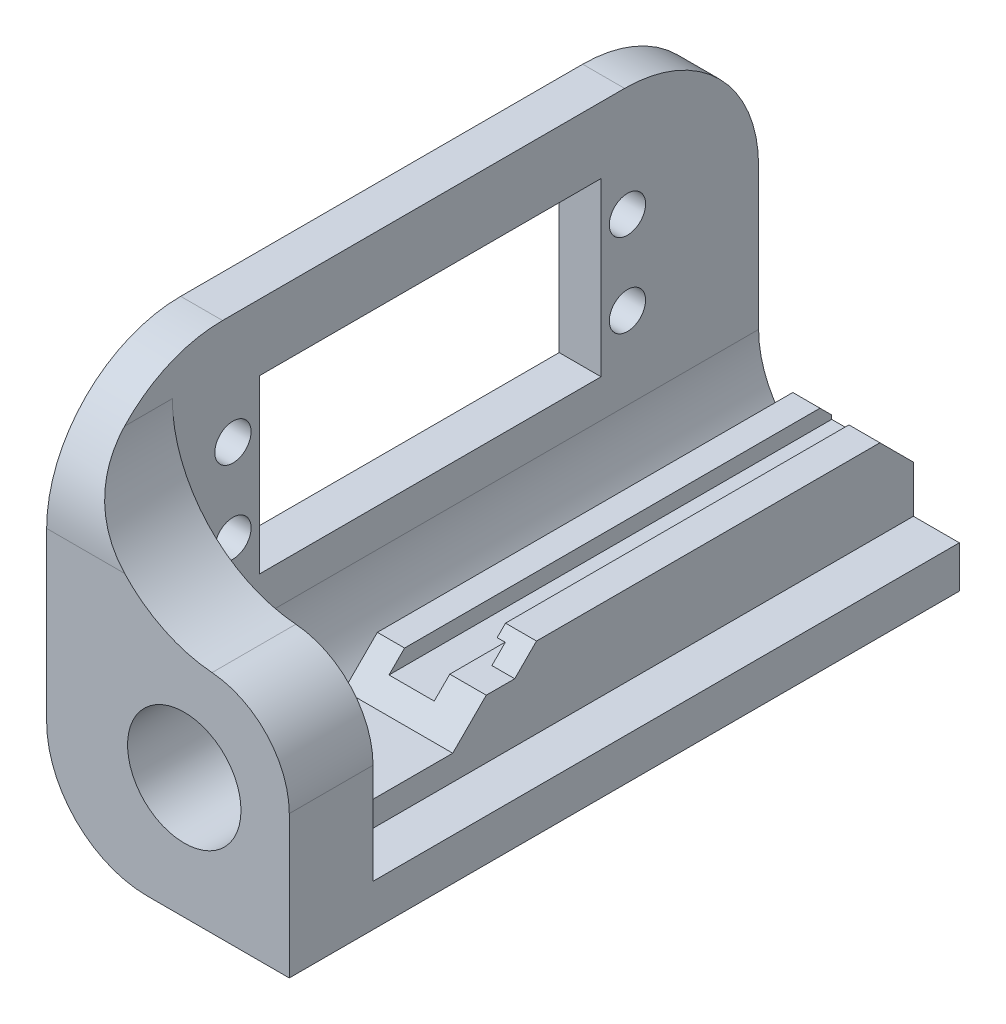
from build123d import *

# Parameters (mm, degrees)
CROQUIS1_W              = 90
CROQUIS1_H              = 80
SALIENTE_EXTRUIR1_DEPTH = 50
CROQUIS2_W              = 85
CROQUIS2_H              = 80
CORTAR_EXTRUIR1_DEPTH   = 23
CROQUIS3_W              = 61.032840672
CROQUIS3_H              = 80
CORTAR_EXTRUIR2_DEPTH   = 32
CROQUIS4_W              = 23.967159328
CROQUIS4_H              = 70
CORTAR_EXTRUIR3_DEPTH   = 22
CROQUIS7_R              = 6.77
CORTAR_EXTRUIR6_DEPTH   = 10
CROQUIS11_W             = 13
CROQUIS11_H             = 70
SALIENTE_EXTRUIR2_DEPTH = 2
CROQUIS12_W             = 13
CROQUIS12_H             = 55
SALIENTE_EXTRUIR3_DEPTH = 5
REDONDEO3_R             = 12
REDONDEO4_R             = 12
CROQUIS14_W             = 13
CROQUIS14_H             = 13
SALIENTE_EXTRUIR4_DEPTH = 1
CROQUIS17_W             = 2.726828244
CROQUIS17_H             = 50
SALIENTE_EXTRUIR5_DEPTH = 1.6
CROQUIS18_W             = 5
CROQUIS18_H             = 50
SALIENTE_EXTRUIR6_DEPTH = 1
CHAFL_N2_SIZE           = 4
CHAFL_N4_SIZE           = 4
CROQUIS19_R             = 2.165
CORTAR_EXTRUIR10_DEPTH  = 10
CROQUIS20_W             = 5.4
CROQUIS20_H             = 1.857846889
CORTAR_EXTRUIR11_DEPTH  = 80
REDONDEO10_R            = 10
CROQUIS23_W             = 40.8
CROQUIS23_H             = 20.5
CORTAR_EXTRUIR12_DEPTH  = 22
CROQUIS24_W             = 5
CROQUIS24_H             = 80
CORTAR_EXTRUIR14_DEPTH  = 2
REDONDEO13_R            = 16
REDONDEO14_START        = 30
REDONDEO14_DEPTH        = 2.2192
REDONDEO14_START_2      = 32.2192
REDONDEO14_2_DEPTH      = 7.7808
REDONDEO14_START_3      = -40
REDONDEO14_3_DEPTH      = 14.749021125
CORTAR_EXTRUIR16_DEPTH  = 1.3
CHAFL_N5_SIZE           = 5


with BuildPart() as part:
    # Croquis1 → Saliente-Extruir1 (new body)
    with BuildSketch(Plane(origin=(0, 0, 0), x_dir=(1, 0, 0), z_dir=(0, 1, 0))):
        Rectangle(CROQUIS1_W, CROQUIS1_H)
    extrude(amount=SALIENTE_EXTRUIR1_DEPTH)

    # Croquis2 → Cortar-Extruir1 (cut)
    with BuildSketch(Plane(origin=(0, 50, 0), x_dir=(1, 0, 0), z_dir=(0, 1, 0))):
        with Locations((2.5, 0)):
            Rectangle(CROQUIS2_W, CROQUIS2_H)
    extrude(amount=-CORTAR_EXTRUIR1_DEPTH, mode=Mode.SUBTRACT)

    # Croquis3 → Cortar-Extruir2 (cut)
    with BuildSketch(Plane(origin=(0, 27, 0), x_dir=(1, 0, 0), z_dir=(0, 1, 0))):
        with Locations((14.483579664, 0)):
            Rectangle(CROQUIS3_W, CROQUIS3_H)
    extrude(amount=-CORTAR_EXTRUIR2_DEPTH, mode=Mode.SUBTRACT)

    # Croquis4 → Cortar-Extruir3 (cut)
    with BuildSketch(Plane(origin=(0, 27, 0), x_dir=(1, 0, 0), z_dir=(0, 1, 0))):
        with Locations((-28.016420336, 5)):
            Rectangle(CROQUIS4_W, CROQUIS4_H)
    extrude(amount=-CORTAR_EXTRUIR3_DEPTH, mode=Mode.SUBTRACT)

    # Croquis7 → Cortar-Extruir6 (cut)
    with BuildSketch(Plane.XY.offset(40)):
        with Locations((-28.569213332, 14.444335644)):
            Circle(CROQUIS7_R)
    extrude(amount=-CORTAR_EXTRUIR6_DEPTH, mode=Mode.SUBTRACT)

    # Croquis11 → Saliente-Extruir2 (add)
    with BuildSketch(Plane(origin=(0, 5, 0), x_dir=(1, 0, 0), z_dir=(0, 1, 0))):
        with Locations((-28.016420336, 5)):
            Rectangle(CROQUIS11_W, CROQUIS11_H)
    extrude(amount=SALIENTE_EXTRUIR2_DEPTH)

    # Croquis12 → Saliente-Extruir3 (add)
    with BuildSketch(Plane(origin=(0, 7, 0), x_dir=(1, 0, 0), z_dir=(0, 1, 0))):
        with Locations((-28.016420336, 12.5)):
            Rectangle(CROQUIS12_W, CROQUIS12_H)
    extrude(amount=SALIENTE_EXTRUIR3_DEPTH)

    # Redondeo3
    # the kernel refuses this fillet: 12 mm, written as the material it adds along each edge
    with BuildSketch(Plane(origin=(-40, 5, 30), x_dir=(1.0, 1.01847082473682e-12, 0), z_dir=(0, 0, -1))) as redondeo3_piece_1:
        with BuildLine():
            CenterArc((12, -10.076520531), REDONDEO3_R, 122.890486336, 57.109513664)
            Line((0, -10.076520531), (-0.24, -10.076520531))
            Line((-0.24, -10.076520531), (-0.24, 0))
            Line((-0.24, 0), (0, 0.24))
            ThreePointArc((0, 0.24), (2.741789832, 0.24), (5.353251257, 0.201530411))
            Line((5.353251257, 0.201530411), (5.483579664, 0))
        make_face()
    extrude(amount=70)

    # Redondeo4
    redondeo4_edges = [part.edges().sort_by_distance(p)[0] for p in [
        (-45, 0, 0),
    ]]
    fillet(redondeo4_edges, radius=REDONDEO4_R)

    # Croquis14 → Saliente-Extruir4 (add)
    with BuildSketch(Plane(origin=(0, 7, 0), x_dir=(1, 0, 0), z_dir=(0, 1, 0))):
        with Locations((-28.016420336, -21.5)):
            Rectangle(CROQUIS14_W, CROQUIS14_H)
    extrude(amount=SALIENTE_EXTRUIR4_DEPTH)

    # Croquis17 → Saliente-Extruir5 (add)
    with BuildSketch(Plane(origin=(0, 12, 0), x_dir=(1, 0, 0), z_dir=(0, 1, 0))):
        with Locations((-22.879834458, 15)):
            Rectangle(CROQUIS17_W, CROQUIS17_H)
    extrude(amount=SALIENTE_EXTRUIR5_DEPTH)

    # Croquis18 → Saliente-Extruir6 (add)
    with BuildSketch(Plane(origin=(0, 13.6, 0), x_dir=(1, 0, 0), z_dir=(0, 1, 0))):
        with Locations((-24.016420336, 15)):
            Rectangle(CROQUIS18_W, CROQUIS18_H)
    extrude(amount=SALIENTE_EXTRUIR6_DEPTH)

    # Chaflán2
    chafl_n2_edges = [part.edges().sort_by_distance(p)[0] for p in [
        (-28.016420336, 12, 15),
    ]]
    chamfer(chafl_n2_edges, length=CHAFL_N2_SIZE - 0.0001)  # a hair under: the kernel refuses the full size

    # Chaflán4
    chafl_n4_edges = [part.edges().sort_by_distance(p)[0] for p in [
        (-24.016420336, 14.6, -40),
    ]]
    chamfer(chafl_n4_edges, length=CHAFL_N4_SIZE)

    # Croquis19 → Cortar-Extruir10 (cut)
    with BuildSketch(Plane.ZY.offset(45)):
        with Locations((-24.340228639, 34.810686035)):
            Circle(CROQUIS19_R)
        with Locations((-24.340228639, 24.860686035)):
            Circle(CROQUIS19_R)
        with Locations((22.759771361, 34.810686035)):
            Circle(CROQUIS19_R)
        with Locations((22.759771361, 24.860686035)):
            Circle(CROQUIS19_R)
    extrude(amount=-CORTAR_EXTRUIR10_DEPTH, mode=Mode.SUBTRACT)

    # Croquis20 → Cortar-Extruir11 (cut)
    with BuildSketch(Plane(origin=(0, 0, -40), x_dir=(-1, 0, 0), z_dir=(0, 0, -1))):
        with Locations((28.569213332, 11.071076555)):
            Rectangle(CROQUIS20_W, CROQUIS20_H)
    extrude(amount=-CORTAR_EXTRUIR11_DEPTH, mode=Mode.SUBTRACT)

    # Redondeo10
    redondeo10_edges = [part.edges().sort_by_distance(p)[0] for p in [
        (-16.032840672, 27, 35),
    ]]
    fillet(redondeo10_edges, radius=REDONDEO10_R)

    # Croquis23 → Cortar-Extruir12 (cut)
    with BuildSketch(Plane(origin=(-40, 0, 0), x_dir=(0, 0, -1), z_dir=(1, 0, 0))):
        with Locations((0.790228639, 29.835686035)):
            Rectangle(CROQUIS23_W, CROQUIS23_H)
    extrude(amount=-CORTAR_EXTRUIR12_DEPTH, mode=Mode.SUBTRACT)

    # Croquis24 → Cortar-Extruir14 (cut)
    with BuildSketch(Plane(origin=(0, 50, 0), x_dir=(1, 0, 0), z_dir=(0, 1, 0))):
        with Locations((-42.5, 0)):
            Rectangle(CROQUIS24_W, CROQUIS24_H)
    extrude(amount=-CORTAR_EXTRUIR14_DEPTH, mode=Mode.SUBTRACT)

    # Redondeo13
    redondeo13_edges = [part.edges().sort_by_distance(p)[0] for p in [
        (-42.5, 48, -40),
        (-42.5, 48, 40),
    ]]
    fillet(redondeo13_edges, radius=REDONDEO13_R)

    # Redondeo14: read off the stored shape, not the designer's step
    # Redondeo14 outline → Redondeo14 (add)
    with BuildSketch(Plane.XY.offset(REDONDEO14_START)):
        with BuildLine():
            ThreePointArc((-26.032840672, 27), (-25.641610248, 26.992344007), (-25.250978875, 26.969387751))
            ThreePointArc((-25.250978875, 26.969387751), (-35.747673429, 32.057988118), (-40, 42.920408153))
            Line((-40, 42.920408153), (-40, 27))
            Line((-40, 27), (-26.032840672, 27))
        make_face()
    extrude(amount=REDONDEO14_DEPTH)

    # Redondeo14 2 outline → Redondeo14 2 (add)
    with BuildSketch(Plane.XY.offset(REDONDEO14_START_2)):
        with BuildLine():
            ThreePointArc((-26.032840672, 27), (-25.641610248, 26.992344007), (-25.250978875, 26.969387751))
            ThreePointArc((-25.250978875, 26.969387751), (-35.747673429, 32.057988118), (-40, 42.920408153))
            Line((-40, 42.920408153), (-40, 27))
            Line((-40, 27), (-26.032840672, 27))
        make_face()
    extrude(amount=REDONDEO14_2_DEPTH)

    # Redondeo14 3 outline → Redondeo14 3 (cut)
    with BuildSketch(Plane.YZ.offset(REDONDEO14_START_3)):
        with BuildLine():
            Line((31, 40), (32, 40))
            ThreePointArc((32, 40), (38.583005244, 38.583005244), (44, 34.583005244))
            Line((44, 34.583005244), (44, 41))
            Line((44, 41), (31, 41))
            Line((31, 41), (31, 40))
        make_face()
    extrude(amount=REDONDEO14_3_DEPTH, mode=Mode.SUBTRACT)

    # Croquis25 → Cortar-Extruir16 (cut)
    with BuildSketch(Plane.ZY.offset(26.516420336)):
        Polygon((-36, 14.6), (10, 14.6), (10, 13.6), (-37, 13.6), align=None)
    extrude(amount=-CORTAR_EXTRUIR16_DEPTH, mode=Mode.SUBTRACT)

    # Chaflán5
    # the kernel refuses this chamfer: 5 mm, written as the material it takes off along each edge
    with BuildSketch(Plane(origin=(-8.658005396, 14.6, 10), x_dir=(0, 0, -1), z_dir=(-1, 0, 0))) as chafl_n5_piece_1_section:
        Polygon((CHAFL_N5_SIZE, 0), (0, CHAFL_N5_SIZE), (0, 0), align=None)
    chafl_n5_piece_1 = extrude(amount=29.41682988, mode=Mode.PRIVATE)
    chafl_n5_piece_1 = split(chafl_n5_piece_1, bisect_by=Plane(origin=(-8.658005396, 12, 10), z_dir=(0, 1, 0)), keep=Keep.TOP, mode=Mode.PRIVATE)
    add(chafl_n5_piece_1, mode=Mode.SUBTRACT)


solid = part.part
